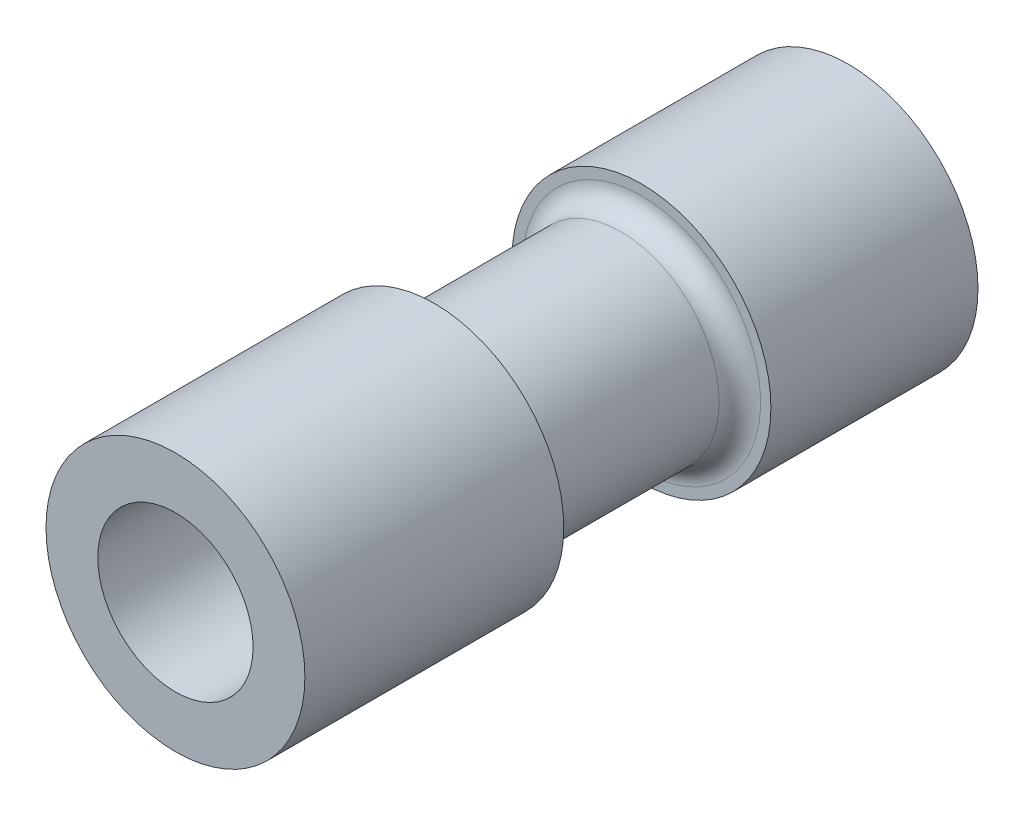
from build123d import *

# Parameters (mm, degrees)
SKETCH1_R                = 2.5
BOSS_EXTRUDE1_DEPTH      = 13
F_2_0_2_DIAMETER_HOLE1_D = 2
SKETCH8_R                = 1.5
CUT_EXTRUDE1_DEPTH       = 8


with BuildPart() as part:
    # Sketch1 → Boss-Extrude1 (new body)
    with BuildSketch(Plane.XY):
        Circle(SKETCH1_R)
    extrude(amount=BOSS_EXTRUDE1_DEPTH)

    # Sketch3 → Cut-Revolve1 (revolve, cut)
    with BuildSketch(Plane(origin=(0, 0, 0), x_dir=(1, 0, 0), z_dir=(0, 1, 0))):
        with BuildLine():
            Line((3.138230266, -4), (2.3, -4))
            ThreePointArc((2.3, -4), (2.017157288, -4.117157288), (1.9, -4.4))
            Line((1.9, -4.4), (1.9, -7.6))
            ThreePointArc((1.9, -7.6), (2.017157288, -7.882842712), (2.3, -8))
            Line((2.3, -8), (3.138230266, -8))
            Line((3.138230266, -8), (3.138230266, -4))
        make_face()
    revolve(axis=Axis((0, 0, 0), (0, 0, 1)), mode=Mode.SUBTRACT)

    # Ø2.0 (2) Diameter Hole1 (through all)
    with Locations(Plane.XY.offset(13)):
        with Locations((0, 0)):
            Hole(F_2_0_2_DIAMETER_HOLE1_D / 2)

    # Sketch8 → Cut-Extrude1 (cut)
    with BuildSketch(Plane.XY.offset(13)):
        Circle(SKETCH8_R)
    extrude(amount=-CUT_EXTRUDE1_DEPTH, mode=Mode.SUBTRACT)


solid = part.part
